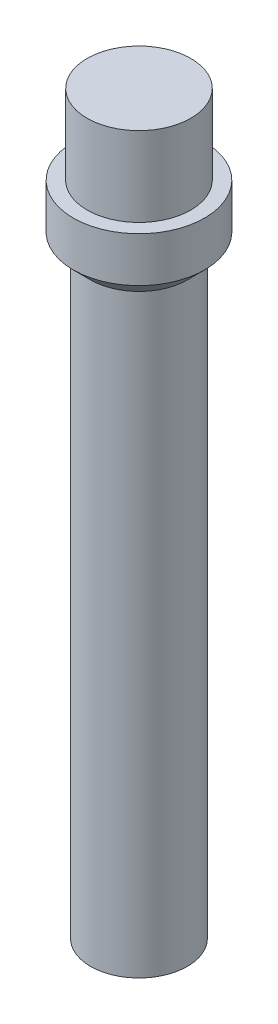
from build123d import *

# Parameters (mm, degrees)
SKETCH1_R           = 1.5
SKETCH1_R_2         = 1.4
BOSS_EXTRUDE1_DEPTH = 2.3
BOSS_EXTRUDE2_START = -1.3
SKETCH1_4_R         = 1.9
SKETCH1_4_R_2       = 1.5
SKETCH1_4_R_3       = 1.4
BOSS_EXTRUDE2_DEPTH = 1.3
SKETCH1_5_R         = 1.4
BOSS_EXTRUDE3_DEPTH = 19
CHAMFER1_SIZE       = 0.5


with BuildPart() as part:
    # Sketch1 → Boss-Extrude1 (new body)
    # profile 1 of 2: a face of its own
    with BuildSketch(Plane(origin=(0, 0, 0), x_dir=(1, 0, 0), z_dir=(0, 1, 0))):
        with Locations(Location((0, 0, 0), (0, 0, 270))):
            Circle(SKETCH1_R)
        Circle(SKETCH1_R_2, mode=Mode.SUBTRACT)
    # profile 2 of 2: a face of its own
    with BuildSketch(Plane(origin=(0, 0, 0), x_dir=(1, 0, 0), z_dir=(0, 1, 0))):
        Circle(SKETCH1_R_2)
    extrude(amount=BOSS_EXTRUDE1_DEPTH)

    # Sketch1<4> → Boss-Extrude2 (add)
    # profile 1 of 3: a face of its own
    with BuildSketch(Plane(origin=(0, 0, 0), x_dir=(1, 0, 0), z_dir=(0, 1, 0)).offset(BOSS_EXTRUDE2_START)):
        with Locations(Location((0, 0, 0), (0, 0, 270))):
            Circle(SKETCH1_4_R)
        with Locations(Location((0, 0, 0), (0, 0, 270))):
            Circle(SKETCH1_4_R_2, mode=Mode.SUBTRACT)
    # profile 2 of 3: a face of its own
    with BuildSketch(Plane(origin=(0, 0, 0), x_dir=(1, 0, 0), z_dir=(0, 1, 0)).offset(BOSS_EXTRUDE2_START)):
        with Locations(Location((0, 0, 0), (0, 0, 270))):
            Circle(SKETCH1_4_R_2)
        Circle(SKETCH1_4_R_3, mode=Mode.SUBTRACT)
    # profile 3 of 3: a face of its own
    with BuildSketch(Plane(origin=(0, 0, 0), x_dir=(1, 0, 0), z_dir=(0, 1, 0)).offset(BOSS_EXTRUDE2_START)):
        Circle(SKETCH1_4_R_3)
    extrude(amount=BOSS_EXTRUDE2_DEPTH)

    # Sketch1<5> → Boss-Extrude3 (add)
    with BuildSketch(Plane(origin=(0, 0, 0), x_dir=(1, 0, 0), z_dir=(0, 1, 0))):
        with Locations(Location((0, 0, 0), (0, 0, 270))):
            Circle(SKETCH1_5_R)
    extrude(amount=-BOSS_EXTRUDE3_DEPTH)

    # Chamfer1
    chamfer1_edges = [part.edges().sort_by_distance(p)[0] for p in [
        (0, -1.3, -1.4),
    ]]
    chamfer(chamfer1_edges, length=CHAMFER1_SIZE - 0.0001)  # a hair under: the kernel refuses the full size


solid = part.part
